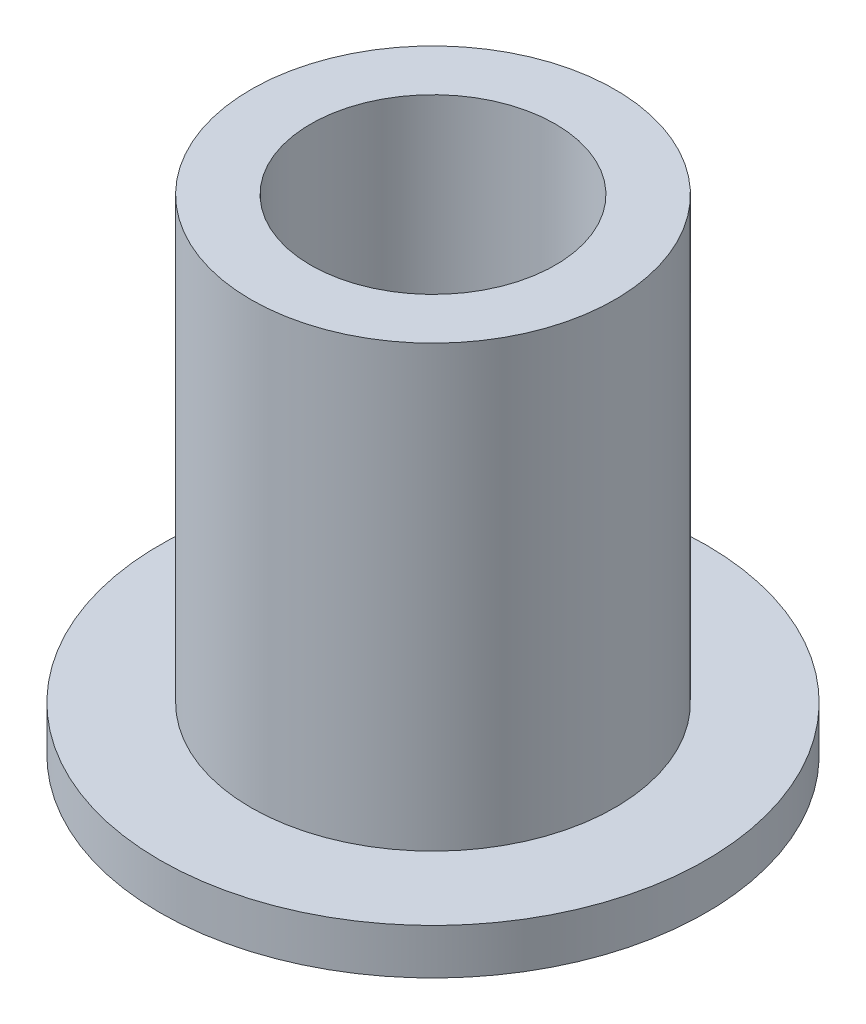
from build123d import *

# Parameters (mm, degrees)
SKETCH2_R           = 4.7625
SKETCH2_R_2         = 3.2004
BOSS_EXTRUDE1_DEPTH = 12.7
SKETCH3_R           = 7.14375
SKETCH3_R_2         = 4.7625
BOSS_EXTRUDE2_DEPTH = 1.190625


with BuildPart() as part:
    # Sketch2 → Boss-Extrude1 (new body)
    with BuildSketch(Plane(origin=(0, 0, 0), x_dir=(1, 0, 0), z_dir=(0, 1, 0))):
        Circle(SKETCH2_R)
        Circle(SKETCH2_R_2, mode=Mode.SUBTRACT)
    extrude(amount=BOSS_EXTRUDE1_DEPTH)

    # Sketch3 → Boss-Extrude2 (add)
    with BuildSketch(Plane(origin=(0, 0, 0), x_dir=(1, 0, 0), z_dir=(0, 1, 0))):
        Circle(SKETCH3_R)
        Circle(SKETCH3_R_2, mode=Mode.SUBTRACT)
    extrude(amount=BOSS_EXTRUDE2_DEPTH)


solid = part.part
